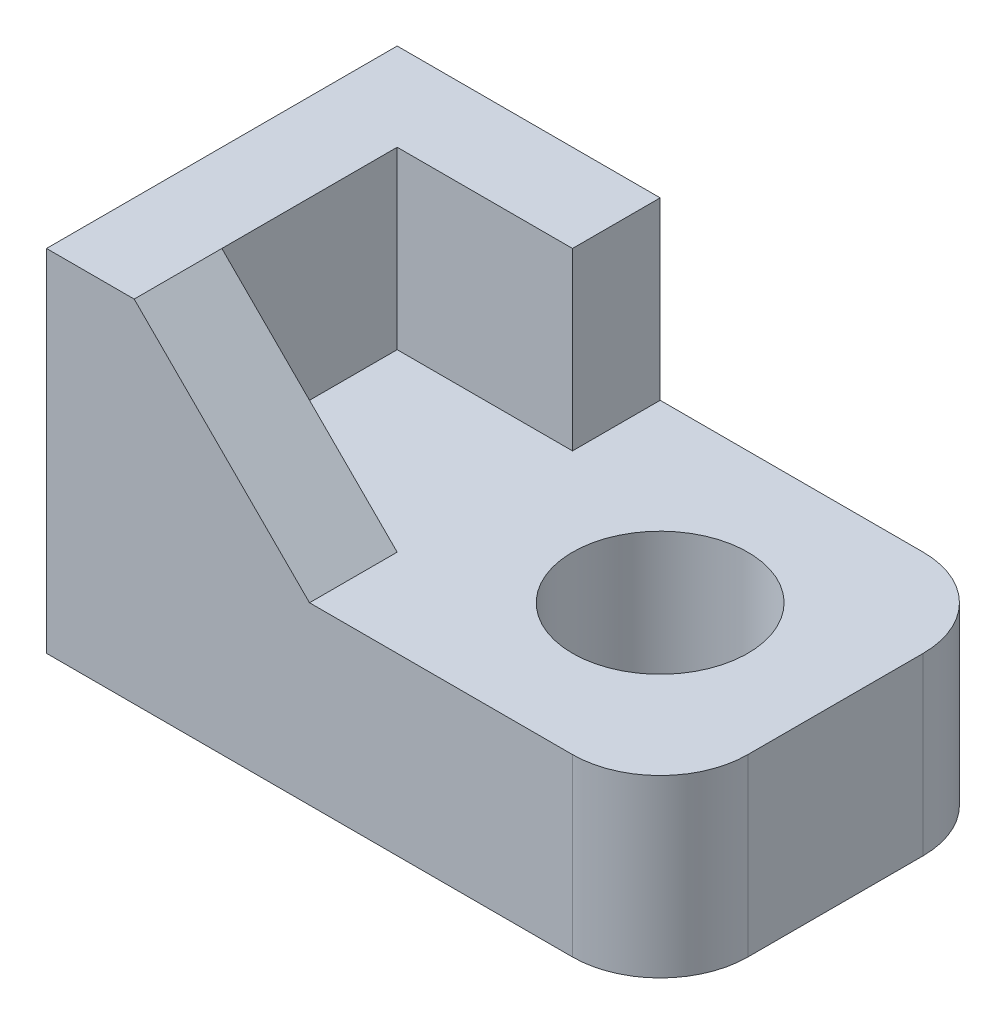
from build123d import *

# Parameters (mm, degrees)
BOSS_EXTRUDE2_DEPTH = 20
SKETCH3_R           = 10
CUT_EXTRUDE1_DEPTH  = 84.066238629
BOSS_EXTRUDE3_DEPTH = 20
RIB1_REACH          = 85.066
SKETCH6_WALL_W      = 196.416748506
SKETCH6_WALL_H      = 10


with BuildPart() as part:
    # Sketch2 → Boss-Extrude2 (new body)
    with BuildSketch(Plane(origin=(0, 0, 0), x_dir=(1, 0, 0), z_dir=(0, 1, 0))):
        with BuildLine():
            Line((-10, 0), (-70, 0))
            Line((-70, 0), (-70, 40))
            Line((-70, 40), (-10, 40))
            ThreePointArc((-10, 40), (-2.928932188, 37.071067812), (0, 30))
            Line((0, 30), (0, 10))
            ThreePointArc((0, 10), (-2.928932188, 2.928932188), (-10, 0))
        make_face()
    extrude(amount=-BOSS_EXTRUDE2_DEPTH)

    # Sketch3 → Cut-Extrude1 (cut, through all)
    with BuildSketch(Plane(origin=(0, 0, 0), x_dir=(1, 0, 0), z_dir=(0, 1, 0))):
        with Locations((-20, 20)):
            Circle(SKETCH3_R)
    extrude(amount=-CUT_EXTRUDE1_DEPTH, mode=Mode.SUBTRACT)

    # Sketch5 → Boss-Extrude3 (add)
    with BuildSketch(Plane(origin=(0, 0, 0), x_dir=(1, 0, 0), z_dir=(0, 1, 0))):
        Polygon((-70, 40), (-40, 40), (-40, 30), (-60, 30), (-60, 0), (-70, 0), align=None)
    extrude(amount=BOSS_EXTRUDE3_DEPTH)

    # Sketch6 wall → Rib1 (add, up to next)
    with BuildSketch(Plane(origin=(-50, 10, 0), x_dir=(0.707106781187, -0.707106781187, 0), z_dir=(0.707106781187, 0.707106781187, 0)), mode=Mode.PRIVATE) as rib1_sk1:
        with Locations((0, 5)):
            Rectangle(SKETCH6_WALL_W, SKETCH6_WALL_H)
    rib1_tool1 = extrude(rib1_sk1.sketch, amount=-RIB1_REACH, mode=Mode.PRIVATE) - part.part
    add(rib1_tool1.solids().sort_by_distance((-50, 10, 0))[0])


solid = part.part
